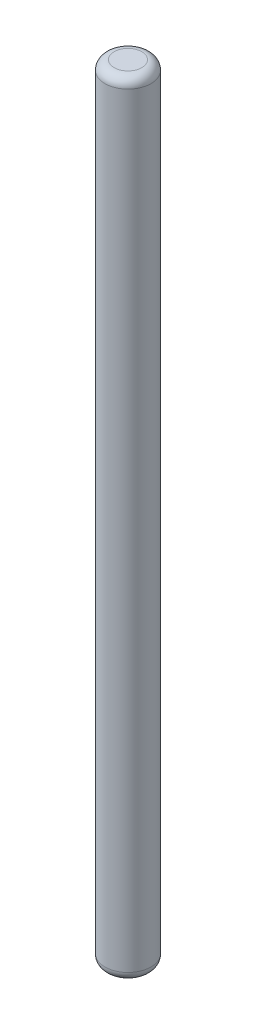
from build123d import *

# Parameters (mm, degrees)
SKETCH2_R           = 2.5
BOSS_EXTRUDE1_DEPTH = 85
CUT_EXTRUDE1_START  = -25
CUT_EXTRUDE1_DEPTH  = 25
FILLET1_R           = 1
FILLET2_R           = 1


with BuildPart() as part:
    # Sketch2 → Boss-Extrude1 (new body)
    with BuildSketch(Plane(origin=(0, 0, 0), x_dir=(1, 0, 0), z_dir=(0, 1, 0))):
        with Locations(Location((0.061061942, 0.061061942, 0), (0, 0, 270))):
            Circle(SKETCH2_R)
    extrude(amount=BOSS_EXTRUDE1_DEPTH)

    # Sketch3 → Cut-Extrude1 (cut)
    with BuildSketch(Plane(origin=(0, 85, 0), x_dir=(1, 0, 0), z_dir=(0, 1, 0)).offset(CUT_EXTRUDE1_START)):
        with BuildLine():
            Line((-1.00625914, 2.321775482), (1.173082806, 2.300126389))
            ThreePointArc((1.173082806, 2.300126389), (0.085895154, 2.560938601), (-1.00625914, 2.321775482))
        make_face()
    extrude(amount=CUT_EXTRUDE1_DEPTH, mode=Mode.SUBTRACT)

    # Fillet1
    # the kernel refuses this fillet: 1 mm, written as the material it takes off along each edge
    with BuildSketch(Plane(origin=(0.061061942, 85, -0.061061942), x_dir=(0.5312663336495629, 0, -0.8472048646759243), z_dir=(0.8472048646759243, 0, 0.5312663336495629))) as fillet1_piece_1:
        with BuildLine():
            CenterArc((2.5 - FILLET1_R, -FILLET1_R), FILLET1_R, 0, 90)
            Line((2.5 - FILLET1_R, 0), (2.5, 0))
            Line((2.5, 0), (2.5, -FILLET1_R))
        make_face()
    revolve(axis=Axis((0.061061942, 85, -0.061061942), (0, 1, 0)), revolution_arc=212.091055881, mode=Mode.SUBTRACT)
    with BuildSketch(Plane(origin=(0.061061942, 85, -0.061061942), x_dir=(0, 0, 1), z_dir=(-1, 0, 0))) as fillet1_piece_2:
        with BuildLine():
            CenterArc((2.5 - FILLET1_R, -FILLET1_R), FILLET1_R, 0, 90)
            Line((2.5 - FILLET1_R, 0), (2.5, 0))
            Line((2.5, 0), (2.5, -FILLET1_R))
        make_face()
    revolve(axis=Axis((0.061061942, 85, -0.061061942), (0, 1, 0)), revolution_arc=210.951767977, mode=Mode.SUBTRACT)

    # Fillet2
    fillet2_edges = [part.edges().sort_by_distance(p)[0] for p in [
        (0.061061942, 0, -2.561061942),
    ]]
    fillet(fillet2_edges, radius=FILLET2_R)


solid = part.part
